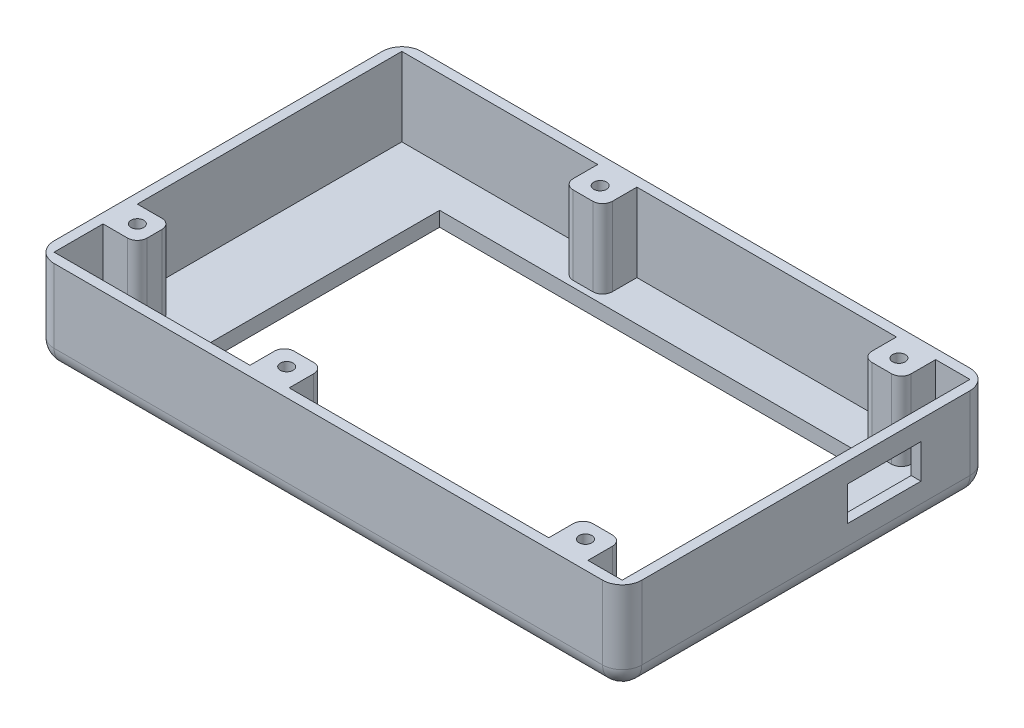
from build123d import *

# Parameters (mm, degrees)
SKETCH1_W           = 120
SKETCH1_H           = 75
BOSS_EXTRUDE1_DEPTH = 19
SKETCH2_W           = 116
SKETCH2_H           = 71
CUT_EXTRUDE1_DEPTH  = 16
FILLET1_R           = 4
SKETCH5_W           = 84.99
SKETCH5_H           = 54.96
CUT_EXTRUDE2_DEPTH  = 3
SKETCH6_W           = 8
SKETCH6_H           = 7
SKETCH6_W_2         = 7
BOSS_EXTRUDE2_DEPTH = 16
SKETCH7_R           = 1.3
CUT_EXTRUDE3_DEPTH  = 10
FILLET2_R           = 2
SKETCH8_W           = 15
SKETCH8_H           = 7
CUT_EXTRUDE4_DEPTH  = 10


with BuildPart() as part:
    # Sketch1 → Boss-Extrude1 (new body)
    with BuildSketch(Plane(origin=(0, 0, 0), x_dir=(1, 0, 0), z_dir=(0, 1, 0))):
        Rectangle(SKETCH1_W, SKETCH1_H)
    extrude(amount=BOSS_EXTRUDE1_DEPTH)

    # Sketch2 → Cut-Extrude1 (cut)
    with BuildSketch(Plane(origin=(0, 19, 0), x_dir=(1, 0, 0), z_dir=(0, 1, 0))):
        Rectangle(SKETCH2_W, SKETCH2_H)
    extrude(amount=-CUT_EXTRUDE1_DEPTH, mode=Mode.SUBTRACT)

    # Fillet1
    fillet1_edges = [part.edges().sort_by_distance(p)[0] for p in [
        (-60, 9.5, -37.5),
        (-60, 9.5, 37.5),
        (-60, 0, 0),
        (60, 9.5, -37.5),
        (0, 0, -37.5),
        (60, 0, 0),
        (0, 0, 37.5),
        (60, 9.5, 37.5),
    ]]
    fillet(fillet1_edges, radius=FILLET1_R)

    # Sketch5 → Cut-Extrude2 (cut)
    with BuildSketch(Plane.XZ):
        with Locations((0.455, 0.22)):
            Rectangle(SKETCH5_W, SKETCH5_H)
    extrude(amount=-CUT_EXTRUDE2_DEPTH, mode=Mode.SUBTRACT)

    # Sketch6 → Boss-Extrude2 (add)
    with BuildSketch(Plane(origin=(0, 3, 0), x_dir=(1, 0, 0), z_dir=(0, 1, 0))):
        with Locations((47, -32)):
            Rectangle(SKETCH6_W, SKETCH6_H)
        with Locations((47, 32)):
            Rectangle(SKETCH6_W, SKETCH6_H)
        with Locations((-14, 32)):
            Rectangle(SKETCH6_W, SKETCH6_H)
        with Locations((-14, -32)):
            Rectangle(SKETCH6_W, SKETCH6_H)
        with Locations((-54.5, -22)):
            Rectangle(SKETCH6_W_2, SKETCH6_H)
    extrude(amount=BOSS_EXTRUDE2_DEPTH)

    # Sketch7 → Cut-Extrude3 (cut)
    with BuildSketch(Plane(origin=(0, 19, 0), x_dir=(1, 0, 0), z_dir=(0, 1, 0))):
        with Locations((47, 32)):
            Circle(SKETCH7_R)
        with Locations((47, -32)):
            Circle(SKETCH7_R)
        with Locations((-14, 32)):
            Circle(SKETCH7_R)
        with Locations((-14, -32)):
            Circle(SKETCH7_R)
        with Locations((-54.5, -22)):
            Circle(SKETCH7_R)
    extrude(amount=-CUT_EXTRUDE3_DEPTH, mode=Mode.SUBTRACT)

    # Fillet2
    fillet2_edges = [part.edges().sort_by_distance(p)[0] for p in [
        (-18, 11, 28.5),
        (-10, 11, 28.5),
        (43, 11, 28.5),
        (51, 11, 28.5),
        (43, 11, -28.5),
        (51, 11, -28.5),
        (-10, 11, -28.5),
        (-18, 11, -28.5),
        (-51, 11, 18.5),
        (-51, 11, 25.5),
    ]]
    fillet(fillet2_edges, radius=FILLET2_R)

    # Sketch8 → Cut-Extrude4 (cut)
    with BuildSketch(Plane(origin=(60, 0, 0), x_dir=(0, 0, -1), z_dir=(1, 0, 0))):
        with Locations((16, 11.5)):
            Rectangle(SKETCH8_W, SKETCH8_H)
    extrude(amount=-CUT_EXTRUDE4_DEPTH, mode=Mode.SUBTRACT)


solid = part.part
